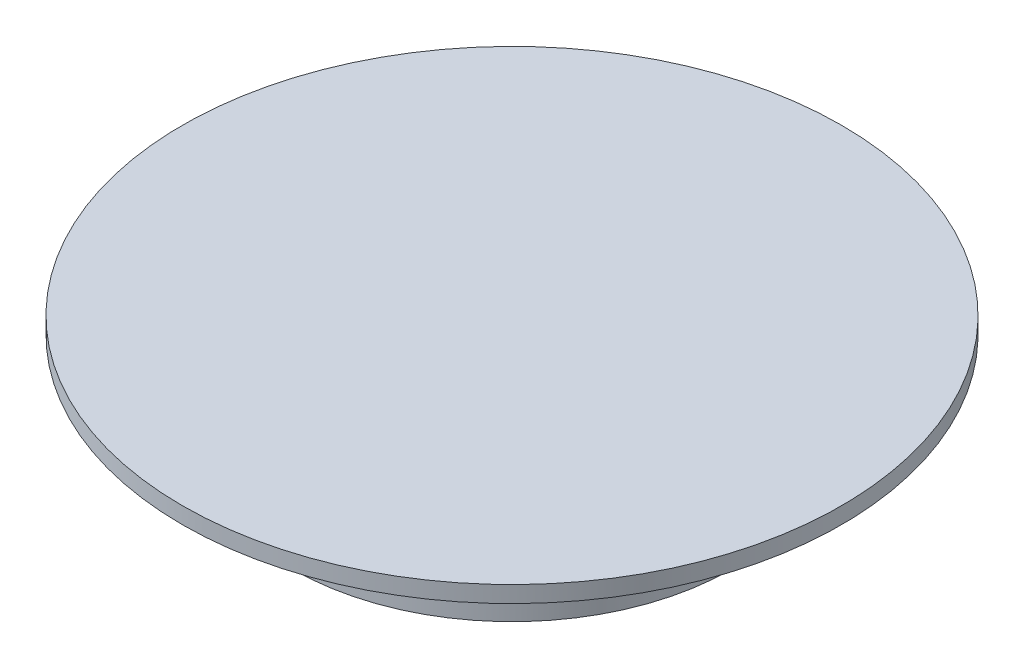
from build123d import *

# Parameters (mm, degrees)
FILLET1_R = 3


with BuildPart() as part:
    # Sketch1 → Revolve1 (revolve)
    with BuildSketch(Plane.XY):
        Polygon((-40, 20), (-60, 20), (-60, 17), (-40, 17), (-40, 0), (-35, 0), (-35, 17), (0, 17), (0, 20), align=None)
    revolve(axis=Axis((0, -63.953488372, 0), (0, 1, 0)))

    # Fillet1
    fillet1_edges = [part.edges().sort_by_distance(p)[0] for p in [
        (40, 17, 0),
    ]]
    fillet(fillet1_edges, radius=FILLET1_R)


solid = part.part
